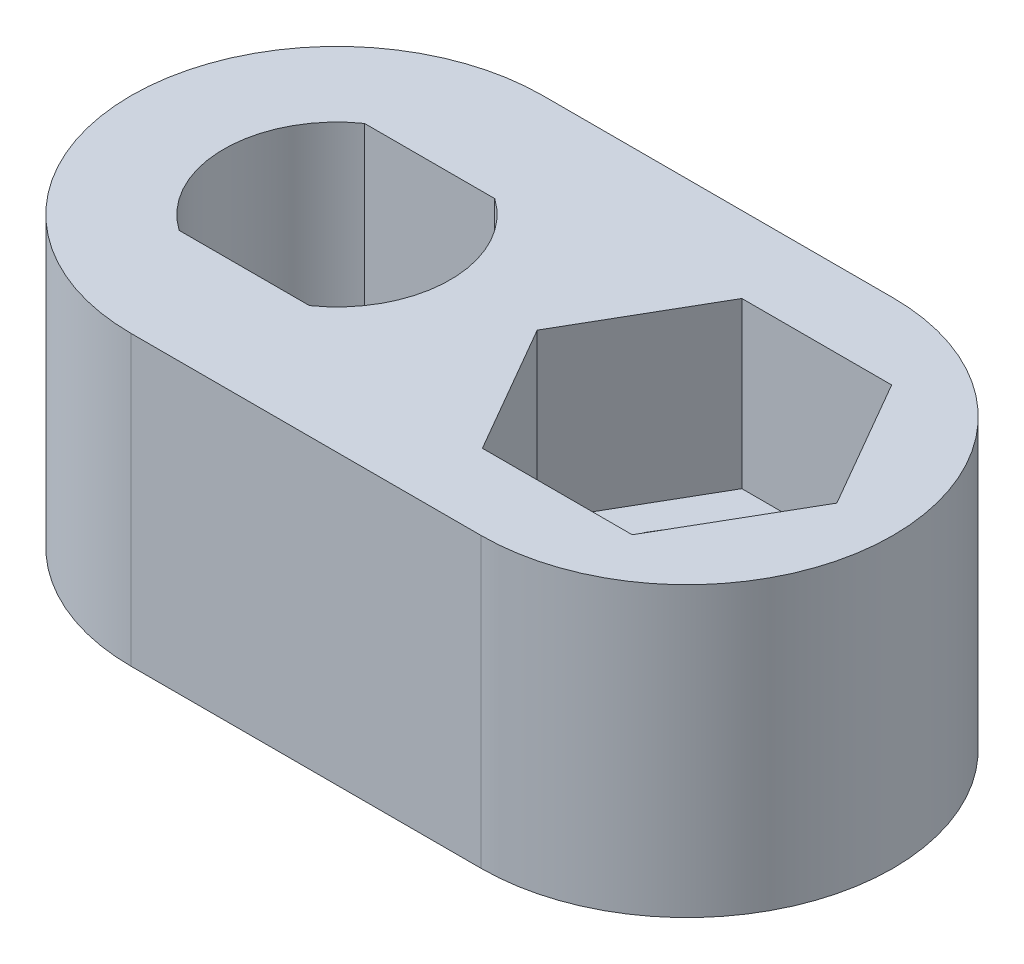
from build123d import *

# Parameters (mm, degrees)
EXTRUDE_1_DEPTH              = 7
CUT_EXTRUDE_1_DEPTH          = 4
HOLE_WIZARD_M3_1_D           = 3.9
HOLE_WIZARD_M3_1_DEPTH       = 7.5
HOLE_WIZARD_M3_1_CSINK_D     = 7.22
HOLE_WIZARD_M3_1_CSINK_ANGLE = 90
HOLE_WIZARD_M3_1_TIP         = 1.171678207
HOLE_WIZARD_1_D              = 4.65
CUT_EXTRUDE_2_DEPTH          = 4


with BuildPart() as part:
    # 草图1 → 凸台-拉伸1 (new body)
    with BuildSketch(Plane(origin=(0, 0, 0), x_dir=(1, 0, 0), z_dir=(0, 1, 0))):
        with BuildLine():
            Line((0, 5), (8.5, 5))
            ThreePointArc((8.5, 5), (13.5, 0), (8.5, -5))
            Line((8.5, -5), (0, -5))
            ThreePointArc((0, -5), (-5, 0), (0, 5))
        make_face()
    extrude(amount=EXTRUDE_1_DEPTH)

    # 草图2 → 切除-拉伸1 (cut)
    with BuildSketch(Plane(origin=(0, 7, 0), x_dir=(1, 0, 0), z_dir=(0, 1, 0))):
        with BuildLine():
            Line((1.58113883, 2.25), (-1.58113883, 2.25))
            ThreePointArc((-1.58113883, 2.25), (-2.75, 0), (-1.58113883, -2.25))
            Line((-1.58113883, -2.25), (1.58113883, -2.25))
            ThreePointArc((1.58113883, -2.25), (2.75, 0), (1.58113883, 2.25))
        make_face()
    extrude(amount=-CUT_EXTRUDE_1_DEPTH, mode=Mode.SUBTRACT)

    # M3 六角凹锥坑螺钉的锥形沉头孔1
    with Locations(Plane(origin=(0, 0, 0), x_dir=(-1, 0, 0), z_dir=(0, -1, 0))):
        with Locations((0, 0)):
            CounterSinkHole(HOLE_WIZARD_M3_1_D / 2, HOLE_WIZARD_M3_1_CSINK_D / 2, depth=HOLE_WIZARD_M3_1_DEPTH, counter_sink_angle=HOLE_WIZARD_M3_1_CSINK_ANGLE)
            with Locations((0, 0, -(HOLE_WIZARD_M3_1_DEPTH + HOLE_WIZARD_M3_1_TIP / 2))):  # 118° drill point
                Cone(0, HOLE_WIZARD_M3_1_D / 2, HOLE_WIZARD_M3_1_TIP, mode=Mode.SUBTRACT)

    # 孔1 (through all)
    with Locations(Plane(origin=(0, 0, 0), x_dir=(-1, 0, 0), z_dir=(0, -1, 0))):
        with Locations((-8.5, 0)):
            Hole(HOLE_WIZARD_1_D / 2)

    # 草图9 → 切除-拉伸2 (cut)
    with BuildSketch(Plane(origin=(0, 7, 0), x_dir=(1, 0, 0), z_dir=(0, 1, 0))):
        Polygon((10.318653348, 3.15), (6.681346652, 3.15), (4.862693304, 0), (6.681346652, -3.15), (10.318653348, -3.15), (12.137306696, 0), align=None)
    extrude(amount=-CUT_EXTRUDE_2_DEPTH, mode=Mode.SUBTRACT)


solid = part.part
